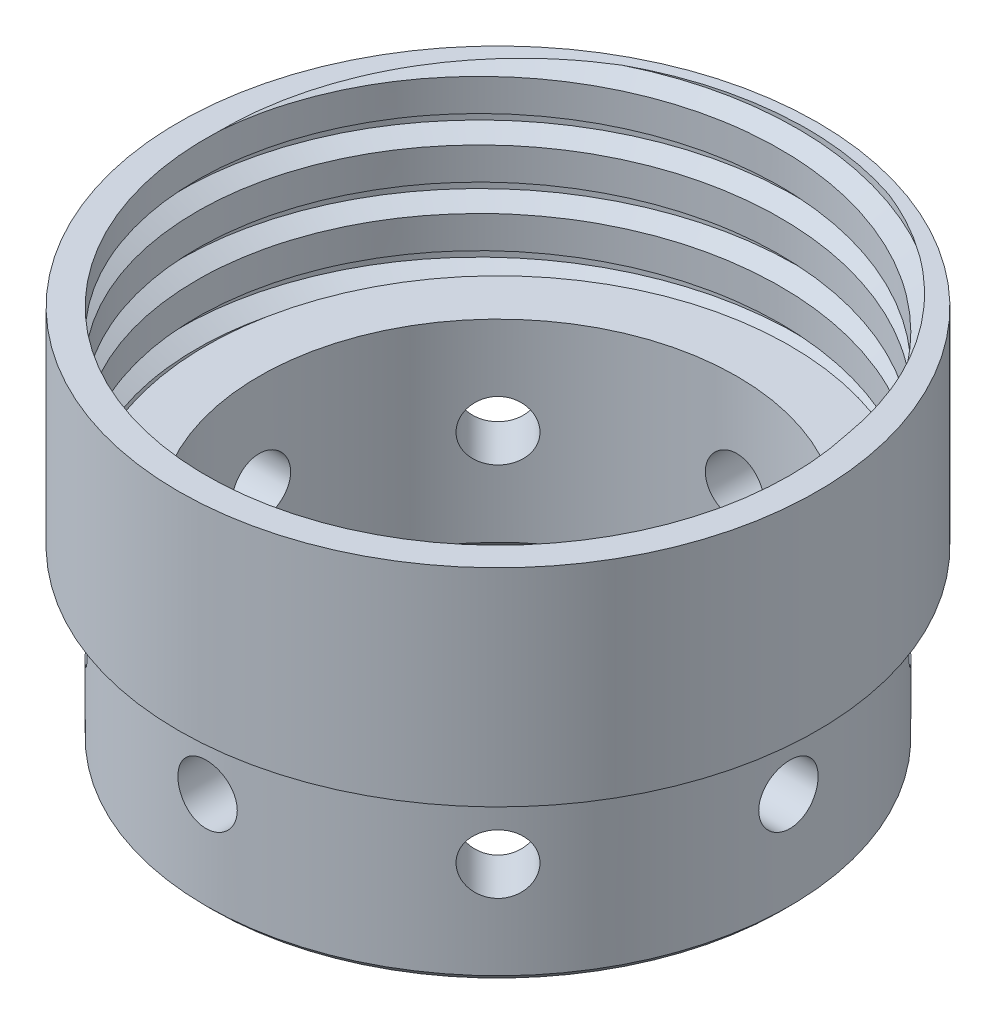
from build123d import *

# Parameters (mm, degrees)
ROSCA1_PITCH            = 8.6
CUT_EXTRUDE1_DEPTH      = 111.884008482
CUT_EXTRUDE1_DEPTH_BACK = 111.884008482
SKETCH303_R             = 4.3
CUT_EXTRUDE2_DEPTH      = 111.884008482
CUT_EXTRUDE2_DEPTH_BACK = 111.884008482
SKETCH304_R             = 4.3
CUT_EXTRUDE3_DEPTH      = 118.2941574
CUT_EXTRUDE3_DEPTH_BACK = 118.2941574
SKETCH306_R             = 4.3
CUT_EXTRUDE4_DEPTH      = 118.2941574
CUT_EXTRUDE4_DEPTH_BACK = 118.2941574
SKETCH307_R             = 4.3
CHAFL_N2_SIZE           = 1


with BuildPart() as part:
    # Sketch294 → Revolve1 (revolve)
    with BuildSketch(Plane.XY, mode=Mode.PRIVATE) as revolve1_sk:
        Polygon((-46.28, 0), (-46.28, -30), (-42.28, -30), (-42.28, -55), (-34.6, -55), (-34.6, -26), (-42.28, -26), (-42.28, 0), align=None)
    revolve(revolve1_sk.sketch.rotate(Axis((0, 0, 0), (0, 1, 0)), 270), axis=Axis((0, 0, 0), (0, 1, 0)))

    # Rosca1: arcs per turn and ends read off the stored shape
    # Rosca1: the profile of Perfil de rosca2 profile screwed along a right-hand helix through 3.953489 turns, 16 arcs to a turn; built about Z, then put on its axis
    rosca1_z = Axis((0, 0, 0), (0, 0, 1))
    rosca1_corners = [(42.2797, 0, 3.937673219), (42.2797, 0, -0.000173205), (44.71569646, 0, 1.406250007), (44.71569646, 0, 2.531250007)]
    with BuildLine(mode=Mode.PRIVATE) as rosca1_profile:
        Line(rosca1_corners[0], rosca1_corners[1])
        Line(rosca1_corners[1], rosca1_corners[2])
        Line(rosca1_corners[2], rosca1_corners[3])
        Line(rosca1_corners[3], rosca1_corners[0])
    rosca1_cap = Face(rosca1_profile.wire())
    rosca1_turn_angles = [0, 11.25, 22.5, 33.75, 45, 56.25, 67.5, 78.75, 90, 101.25, 112.5, 123.75, 135, 146.25, 157.5, 168.75, 180, 191.25, 202.5, 213.75, 225, 236.25, 247.5, 258.75, 270, 281.25, 292.5, 303.75, 315, 326.25, 337.5, 348.75, 360]
    rosca1_turn_weights = [1, 0.9807852804032304, 1, 0.9807852804032304, 1, 0.9807852804032304, 1, 0.9807852804032304, 1, 0.9807852804032304, 1, 0.9807852804032304, 1, 0.9807852804032304, 1, 0.9807852804032304, 1, 0.9807852804032304, 1, 0.9807852804032304, 1, 0.9807852804032304, 1, 0.9807852804032304, 1, 0.9807852804032304, 1, 0.9807852804032304, 1, 0.9807852804032304, 1, 0.9807852804032304, 1]
    rosca1_turn_rails = [Edge.make_bspline([Vector(p[0], p[1], 0).rotate(rosca1_z, rosca1_turn_angles[k]) / rosca1_turn_weights[k] + Vector(0, 0, p[2] + ROSCA1_PITCH * rosca1_turn_angles[k] / 360) for k in range(33)], [0, 0, 0, 1, 1, 2, 2, 3, 3, 4, 4, 5, 5, 6, 6, 7, 7, 8, 8, 9, 9, 10, 10, 11, 11, 12, 12, 13, 13, 14, 14, 15, 15, 16, 16, 16], 2, rosca1_turn_weights) for p in rosca1_corners]
    rosca1_turn_sides = [Face.make_surface_from_curves(rosca1_turn_rails[p[0]], rosca1_turn_rails[p[1]]) for p in [(0, 1), (1, 2), (2, 3), (3, 0)]]
    rosca1_last_angles = [1080, 1091.25, 1102.5, 1113.75, 1125, 1136.25, 1147.5, 1158.75, 1170, 1181.25, 1192.5, 1203.75, 1215, 1226.25, 1237.5, 1248.75, 1260, 1271.25, 1282.5, 1293.75, 1305, 1316.25, 1327.5, 1338.75, 1350, 1361.25, 1372.5, 1383.75, 1395, 1406.25, 1417.5, 1420.378, 1423.256]
    rosca1_last_weights = [1, 0.9807852804032304, 1, 0.9807852804032304, 1, 0.9807852804032304, 1, 0.9807852804032304, 1, 0.9807852804032304, 1, 0.9807852804032304, 1, 0.9807852804032304, 1, 0.9807852804032304, 1, 0.9807852804032304, 1, 0.9807852804032304, 1, 0.9807852804032304, 1, 0.9807852804032304, 1, 0.9807852804032304, 1, 0.9807852804032304, 1, 0.9807852804032304, 1, 0.998738709855117, 1]
    rosca1_last_rails = [Edge.make_bspline([Vector(p[0], p[1], 0).rotate(rosca1_z, rosca1_last_angles[k]) / rosca1_last_weights[k] + Vector(0, 0, p[2] + ROSCA1_PITCH * rosca1_last_angles[k] / 360) for k in range(33)], [0, 0, 0, 1, 1, 2, 2, 3, 3, 4, 4, 5, 5, 6, 6, 7, 7, 8, 8, 9, 9, 10, 10, 11, 11, 12, 12, 13, 13, 14, 14, 15, 15, 16, 16, 16], 2, rosca1_last_weights) for p in rosca1_corners]
    rosca1_last_sides = [Face.make_surface_from_curves(rosca1_last_rails[p[0]], rosca1_last_rails[p[1]]) for p in [(0, 1), (1, 2), (2, 3), (3, 0)]]
    rosca1 = Plane(origin=(0, 4, 0), x_dir=(-1, 0, 0), z_dir=(0, -1, 0)) * Solid(Shell([*[p.moved(Location((0, 0, ROSCA1_PITCH * i))) for i in range(3) for p in rosca1_turn_sides], *rosca1_last_sides, rosca1_cap, rosca1_cap.rotate(rosca1_z, 1423.256).moved(Location((0, 0, ROSCA1_PITCH * 1423.256 / 360)))]))
    add(rosca1, mode=Mode.SUBTRACT)

    # Sketch303 → Cut-Extrude1 (cut, two sides: drawn at the far end of the back side and taken through both)
    with BuildSketch(Plane.XY.offset(38.15).offset(-CUT_EXTRUDE1_DEPTH_BACK)):
        with Locations((0, -40)):
            Circle(SKETCH303_R)
    extrude(amount=CUT_EXTRUDE1_DEPTH + CUT_EXTRUDE1_DEPTH_BACK, mode=Mode.SUBTRACT)

    # Sketch304 → Cut-Extrude2 (cut, two sides: drawn at the far end of the back side and taken through both)
    with BuildSketch(Plane(origin=(38.15, 0, 0), x_dir=(0, 0, -1), z_dir=(1, 0, 0)).offset(-CUT_EXTRUDE2_DEPTH_BACK)):
        with Locations((0, -40)):
            Circle(SKETCH304_R)
    extrude(amount=CUT_EXTRUDE2_DEPTH + CUT_EXTRUDE2_DEPTH_BACK, mode=Mode.SUBTRACT)

    # Sketch306 → Cut-Extrude3 (cut, two sides: drawn at the far end of the back side and taken through both)
    with BuildSketch(Plane(origin=(26.976123702, 0, 26.976123702), x_dir=(0, -1, 0), z_dir=(0.7071067811865464, 0, 0.7071067811865488)).offset(-CUT_EXTRUDE3_DEPTH_BACK)):
        with Locations(Location((40, 0, 0), (0, 0, 90))):
            Circle(SKETCH306_R)
    extrude(amount=CUT_EXTRUDE3_DEPTH + CUT_EXTRUDE3_DEPTH_BACK, mode=Mode.SUBTRACT)

    # Sketch307 → Cut-Extrude4 (cut, two sides: drawn at the far end of the back side and taken through both)
    with BuildSketch(Plane(origin=(26.976123702, 0, -26.976123702), x_dir=(-0.7071067811865465, 0, -0.7071067811865487), z_dir=(0.7071067811865487, 0, -0.7071067811865465)).offset(-CUT_EXTRUDE4_DEPTH_BACK)):
        with Locations((0, -40)):
            Circle(SKETCH307_R)
    extrude(amount=CUT_EXTRUDE4_DEPTH + CUT_EXTRUDE4_DEPTH_BACK, mode=Mode.SUBTRACT)

    # Chaflán2
    chafl_n2_edges = [part.edges().sort_by_distance(p)[0] for p in [
        (0, -55, 34.6),
        (0, -55, 42.28),
    ]]
    chamfer(chafl_n2_edges, length=CHAFL_N2_SIZE)


solid = part.part
